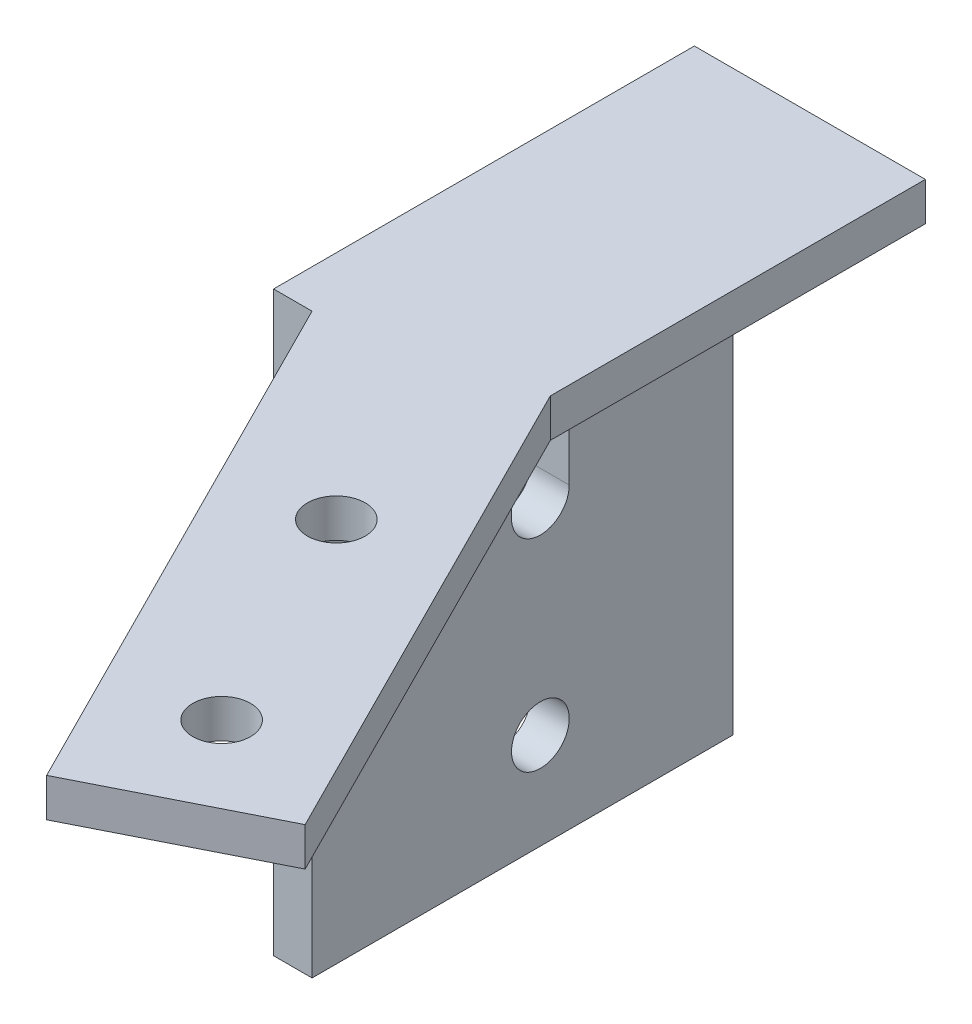
from build123d import *

# Parameters (mm, degrees)
SKETCH1_R              = 1.5
BOSS_EXTRUDE1_DEPTH    = 2
SKETCH2_W              = 2
SKETCH2_H              = 21.859501482
BOSS_EXTRUDE3_DEPTH    = 30
CUT_EXTRUDE1_START     = -12
CUT_EXTRUDE1_OUTLINE_R = 1.5
CUT_EXTRUDE1_DEPTH     = 2
CUT_EXTRUDE2_DEPTH     = 30


# Read off the part's stored shape, not the designer's step: Cut-Extrude1
with BuildPart() as part:
    # Sketch1 → Boss-Extrude1 (new body)
    with BuildSketch(Plane(origin=(0, 0, 0), x_dir=(1, 0, 0), z_dir=(0, 1, 0))):
        Polygon((-10, 30.6), (0, 30.6), (0, 11.116380148), (12.920279645, -14.539262377), (3.988919615, -19.037129429), (-10, 8.740498518), align=None)
        with Locations(Location((0, 0, 0), (0, 0, 270))):
            Circle(SKETCH1_R, mode=Mode.SUBTRACT)
        with Locations(Location((6.043245871, -12, 0), (0, 0, 270))):
            Circle(SKETCH1_R, mode=Mode.SUBTRACT)
    extrude(amount=BOSS_EXTRUDE1_DEPTH)

    # Sketch2 → Boss-Extrude3 (add)
    with BuildSketch(Plane(origin=(0, 2, 0), x_dir=(1, 0, 0), z_dir=(0, 1, 0))):
        with Locations((-11, 19.670249259)):
            Rectangle(SKETCH2_W, SKETCH2_H)
    extrude(amount=-BOSS_EXTRUDE3_DEPTH)

    # Cut-Extrude1 outline → Cut-Extrude1 (cut)
    with BuildSketch(Plane.YZ.offset(CUT_EXTRUDE1_START)):
        with Locations((-23, -20.6)):
            Circle(CUT_EXTRUDE1_OUTLINE_R)
    extrude(amount=CUT_EXTRUDE1_DEPTH, mode=Mode.SUBTRACT)

    # Sketch4 → Cut-Extrude2 (cut)
    with BuildSketch(Plane.ZY.offset(12)):
        with BuildLine():
            Line((-19.1, -3.5), (-19.1, -12.5))
            ThreePointArc((-19.1, -12.5), (-20.6, -14), (-22.1, -12.5))
            Line((-22.1, -12.5), (-22.1, -3.5))
            ThreePointArc((-22.1, -3.5), (-20.6, -2), (-19.1, -3.5))
        make_face()
    extrude(amount=-CUT_EXTRUDE2_DEPTH, mode=Mode.SUBTRACT)


solid = part.part
